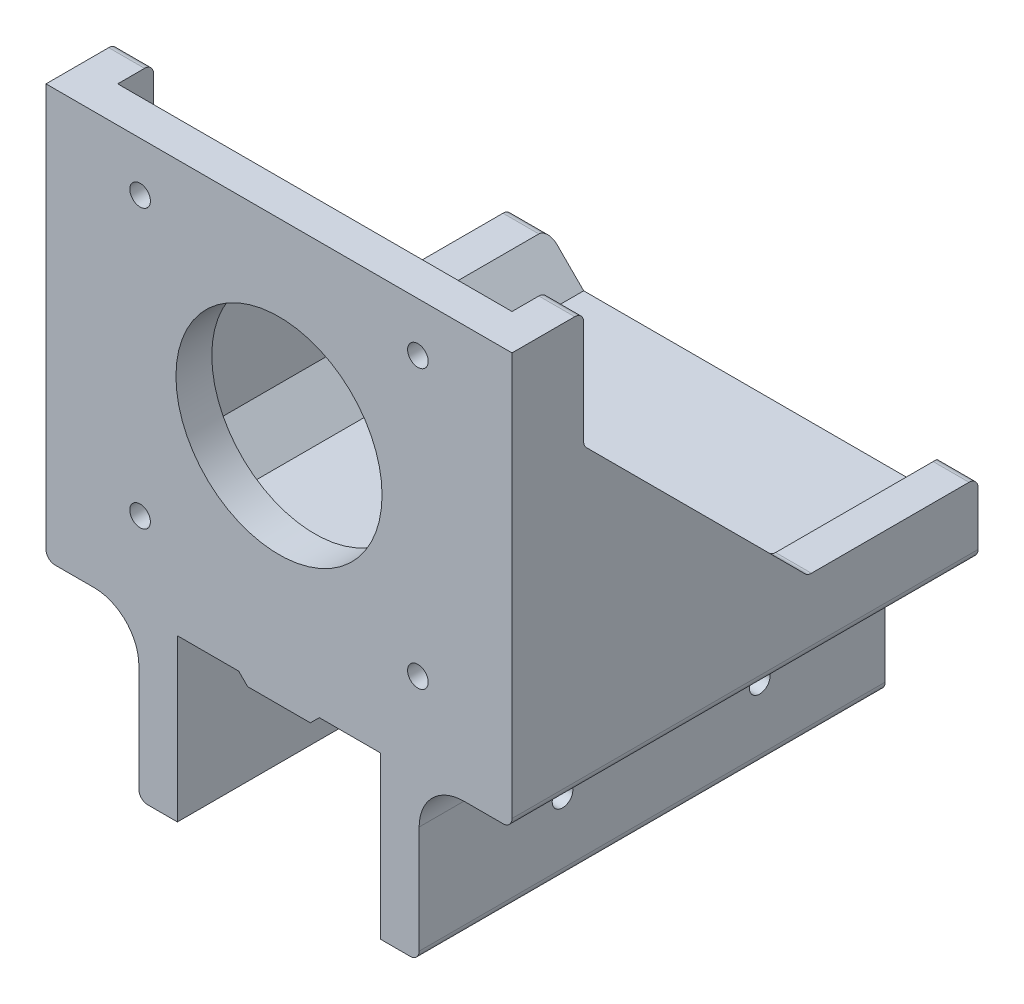
from build123d import *

# Parameters (mm, degrees)
SKETCH1_W               = 52
SKETCH1_H               = 46
SKETCH1_R               = 1.15
SKETCH1_R_2             = 11.5
SKETCH1_W_2             = 4.3
SKETCH1_H_2             = 18
BOSS_EXTRUDE1_DEPTH     = 4
BOSS_EXTRUDE2_DEPTH     = 4
BOSS_EXTRUDE3_DEPTH     = 44
CHAMFER1_SIZE           = 25
CUT_EXTRUDE1_DEPTH      = 70.491006612
CUT_EXTRUDE1_DEPTH_BACK = 70.491006612
SKETCH4_R               = 1.15
FILLET1_R               = 5
FILLET2_R               = 1


with BuildPart() as part:
    # Sketch1 → Boss-Extrude1 (new body)
    # profile 1 of 4: a face of its own
    with BuildSketch(Plane.XY):
        with Locations((0, -2)):
            Rectangle(SKETCH1_W, SKETCH1_H)
        with Locations((15.5, 15.5)):
            Circle(SKETCH1_R, mode=Mode.SUBTRACT)
        with Locations((15.5, -15.5)):
            Circle(SKETCH1_R, mode=Mode.SUBTRACT)
        with Locations((-15.5, -15.5)):
            Circle(SKETCH1_R, mode=Mode.SUBTRACT)
        with Locations((-15.5, 15.5)):
            Circle(SKETCH1_R, mode=Mode.SUBTRACT)
        Circle(SKETCH1_R_2, mode=Mode.SUBTRACT)
    # profile 2 of 4: a face of its own
    with BuildSketch(Plane.XY):
        with Locations((-13.488188518, -34)):
            Rectangle(SKETCH1_W_2, SKETCH1_H_2)
    # profile 3 of 4: a face of its own
    with BuildSketch(Plane.XY):
        with Locations((13.488188518, -34)):
            Rectangle(SKETCH1_W_2, SKETCH1_H_2)
    # profile 4 of 4: a face of its own
    with BuildSketch(Plane.XY):
        Polygon((3.5, -26), (4.5, -25), (-4.5, -25), (-3.5, -26), align=None)
    extrude(amount=BOSS_EXTRUDE1_DEPTH)

    # Sketch2 → Boss-Extrude2 (add)
    with BuildSketch(Plane.XY):
        Polygon((26, 21), (22, 21), (22, -17), (18, -21), (-18, -21), (-22, -17), (-22, 21), (-26, 21), (-26, -25), (-15.638188518, -25), (-15.638188518, -43), (-11.338188518, -43), (-11.338188518, -25), (-4.5, -25), (-3.5, -26), (3.5, -26), (4.5, -25), (11.338188518, -25), (11.338188518, -43), (15.638188518, -43), (15.638188518, -25), (26, -25), align=None)
    extrude(amount=-BOSS_EXTRUDE2_DEPTH)

    # Sketch3 → Boss-Extrude3 (add)
    with BuildSketch(Plane(origin=(0, 0, -4), x_dir=(-1, 0, 0), z_dir=(0, 0, -1))):
        Polygon((-26, -25), (-26, -17), (-22, -17), (-18, -21), (18, -21), (22, -17), (26, -17), (26, -25), (15.638188518, -25), (15.638188518, -43), (11.338188518, -43), (11.338188518, -25), (4.5, -25), (3.5, -26), (-3.5, -26), (-4.5, -25), (-11.338188518, -25), (-11.338188518, -43), (-15.638188518, -43), (-15.638188518, -25), align=None)
    extrude(amount=BOSS_EXTRUDE3_DEPTH)

    # Chamfer1
    chamfer1_edges = [part.edges().sort_by_distance(p)[0] for p in [
        (-24, -17, -4),
        (24, -17, -4),
    ]]
    chamfer(chamfer1_edges, length=CHAMFER1_SIZE)

    # Sketch4 → Cut-Extrude1 (cut, two sides: drawn at the far end of the back side and taken through both)
    with BuildSketch(Plane(origin=(0, 0, 0), x_dir=(0, 0, -1), z_dir=(1, 0, 0)).offset(-CUT_EXTRUDE1_DEPTH_BACK)):
        with Locations(Location((34, -35, 0), (0, 0, 270))):
            Circle(SKETCH4_R)
        with Locations(Location((12, -35, 0), (0, 0, 270))):
            Circle(SKETCH4_R)
    extrude(amount=CUT_EXTRUDE1_DEPTH + CUT_EXTRUDE1_DEPTH_BACK, mode=Mode.SUBTRACT)

    # Fillet1
    fillet1_edges = [part.edges().sort_by_distance(p)[0] for p in [
        (15.638188518, -25, -22),
        (-15.638188518, -25, -22),
    ]]
    fillet(fillet1_edges, radius=FILLET1_R)

    # Fillet2
    # the kernel refuses this fillet: 1 mm, written as the material it adds along each edge
    with BuildSketch(Plane(origin=(-22, -17, -29), x_dir=(0, 0.7071067811865475, 0.7071067811865475), z_dir=(-1, 0, 0))) as fillet2_piece_1_section:
        with BuildLine():
            CenterArc((FILLET2_R * 0.414213562373, FILLET2_R), FILLET2_R, 225, 45)
            Line((-FILLET2_R * 0.292893218813, FILLET2_R * 0.292893218813), (0, 0))
            Line((0, 0), (FILLET2_R * 0.414213562373, 0))
        make_face()
    fillet2_piece_1 = extrude(amount=4, mode=Mode.PRIVATE)
    fillet2_piece_1 = split(fillet2_piece_1, bisect_by=Plane(origin=(-22.109509858, -16.890490142, -28.87205582), z_dir=(0.7071067811865658, 0.7071067811865294, 0)), keep=Keep.TOP, mode=Mode.PRIVATE)
    add(fillet2_piece_1)
    with BuildSketch(Plane(origin=(-22, -17, -29), x_dir=(0, 0.7071067811865475, 0.7071067811865475), z_dir=(-1, 0, 0))) as fillet2_piece_2_section:
        with BuildLine():
            CenterArc((FILLET2_R * 0.414213562373, FILLET2_R), FILLET2_R, 225, 45)
            Line((-FILLET2_R * 0.292893218813, FILLET2_R * 0.292893218813), (0, 0))
            Line((0, 0), (FILLET2_R * 0.414213562373, 0))
        make_face()
    fillet2_piece_2 = extrude(amount=4, mode=Mode.PRIVATE)
    fillet2_piece_2 = split(fillet2_piece_2, bisect_by=Plane(origin=(-23.045900005, -15.954099995, -29.028101444), z_dir=(-0.7071067811865658, -0.7071067811865294, 0)), keep=Keep.TOP, mode=Mode.PRIVATE)
    add(fillet2_piece_2)
    with BuildSketch(Plane(origin=(-22, 8, -4), x_dir=(0, 1, 0), z_dir=(-1, 0, 0))) as fillet2_piece_3:
        with BuildLine():
            CenterArc((FILLET2_R * 0.414213562373, FILLET2_R), FILLET2_R, 225, 45)
            Line((-FILLET2_R * 0.292893218813, FILLET2_R * 0.292893218813), (0, 0))
            Line((0, 0), (FILLET2_R * 0.414213562373, 0))
        make_face()
    extrude(amount=4)
    with BuildSketch(Plane(origin=(26, -17, -29), x_dir=(0, 0, -1), z_dir=(-1, 0, 0))) as fillet2_piece_4_section:
        with BuildLine():
            CenterArc((FILLET2_R * 0.414213562373, -FILLET2_R), FILLET2_R, 90, 45)
            Line((-FILLET2_R * 0.292893218813, -FILLET2_R * 0.292893218813), (0, 0))
            Line((0, 0), (FILLET2_R * 0.414213562373, 0))
        make_face()
    fillet2_piece_4 = extrude(amount=4, mode=Mode.PRIVATE)
    fillet2_piece_4 = split(fillet2_piece_4, bisect_by=Plane(origin=(23.045900005, -15.954099995, -29.028101444), z_dir=(0.7071067811865454, -0.7071067811865498, 0)), keep=Keep.TOP, mode=Mode.PRIVATE)
    add(fillet2_piece_4)
    with BuildSketch(Plane(origin=(26, -17, -29), x_dir=(0, 0, -1), z_dir=(-1, 0, 0))) as fillet2_piece_5_section:
        with BuildLine():
            CenterArc((FILLET2_R * 0.414213562373, -FILLET2_R), FILLET2_R, 90, 45)
            Line((-FILLET2_R * 0.292893218813, -FILLET2_R * 0.292893218813), (0, 0))
            Line((0, 0), (FILLET2_R * 0.414213562373, 0))
        make_face()
    fillet2_piece_5 = extrude(amount=4, mode=Mode.PRIVATE)
    fillet2_piece_5 = split(fillet2_piece_5, bisect_by=Plane(origin=(22.109509858, -16.890490142, -28.87205582), z_dir=(-0.7071067811865454, 0.7071067811865498, 0)), keep=Keep.TOP, mode=Mode.PRIVATE)
    add(fillet2_piece_5)
    with BuildSketch(Plane(origin=(26, 8, -4), x_dir=(0, -0.7071067811865475, -0.7071067811865475), z_dir=(-1, 0, 0))) as fillet2_piece_6:
        with BuildLine():
            CenterArc((FILLET2_R * 0.414213562373, -FILLET2_R), FILLET2_R, 90, 45)
            Line((-FILLET2_R * 0.292893218813, -FILLET2_R * 0.292893218813), (0, 0))
            Line((0, 0), (FILLET2_R * 0.414213562373, 0))
        make_face()
    extrude(amount=4)
    # the kernel refuses this fillet: 1 mm, written as the material it takes off along each edge
    with BuildSketch(Plane(origin=(-19.5, -17, -48), x_dir=(0, -1, 0), z_dir=(-1, 0, 0)), Plane(origin=(-19.5, 21, -4), x_dir=(0, -1, 0), z_dir=(-1, 0, 0)), Plane(origin=(28.5, 21, -4), x_dir=(0, -1, 0), z_dir=(-1, 0, 0))) as fillet2_2_piece_1:
        with BuildLine():
            CenterArc((FILLET2_R, FILLET2_R), FILLET2_R, 180, 90)
            Line((0, FILLET2_R), (0, 0))
            Line((0, 0), (FILLET2_R, 0))
        make_face()
    extrude(amount=9, mode=Mode.SUBTRACT)
    with BuildSketch(Plane(origin=(28.5, -17, -48), x_dir=(0, 0, 1), z_dir=(-1, 0, 0))) as fillet2_2_piece_2:
        with BuildLine():
            CenterArc((FILLET2_R, -FILLET2_R), FILLET2_R, 90, 90)
            Line((0, -FILLET2_R), (0, 0))
            Line((0, 0), (FILLET2_R, 0))
        make_face()
    extrude(amount=9, mode=Mode.SUBTRACT)
    with BuildSketch(Plane(origin=(26, -25, 6.5), x_dir=(0, 1, 0), z_dir=(0, 0, -1)), Plane(origin=(-15.638188518, -43, 6.5), x_dir=(1, 0, 0), z_dir=(0, 0, -1))) as fillet2_2_piece_3:
        with BuildLine():
            CenterArc((FILLET2_R, -FILLET2_R), FILLET2_R, 90, 90)
            Line((0, -FILLET2_R), (0, 0))
            Line((0, 0), (FILLET2_R, 0))
        make_face()
    extrude(amount=57, mode=Mode.SUBTRACT)
    with BuildSketch(Plane(origin=(15.638188518, -43, 6.5), x_dir=(-1, 0, 0), z_dir=(0, 0, -1)), Plane(origin=(-26, -25, -50.5), x_dir=(1, 0, 0), z_dir=(0, 0, 1))) as fillet2_2_piece_4:
        with BuildLine():
            CenterArc((FILLET2_R, FILLET2_R), FILLET2_R, 180, 90)
            Line((0, FILLET2_R), (0, 0))
            Line((0, 0), (FILLET2_R, 0))
        make_face()
    extrude(amount=57, mode=Mode.SUBTRACT)


solid = part.part
